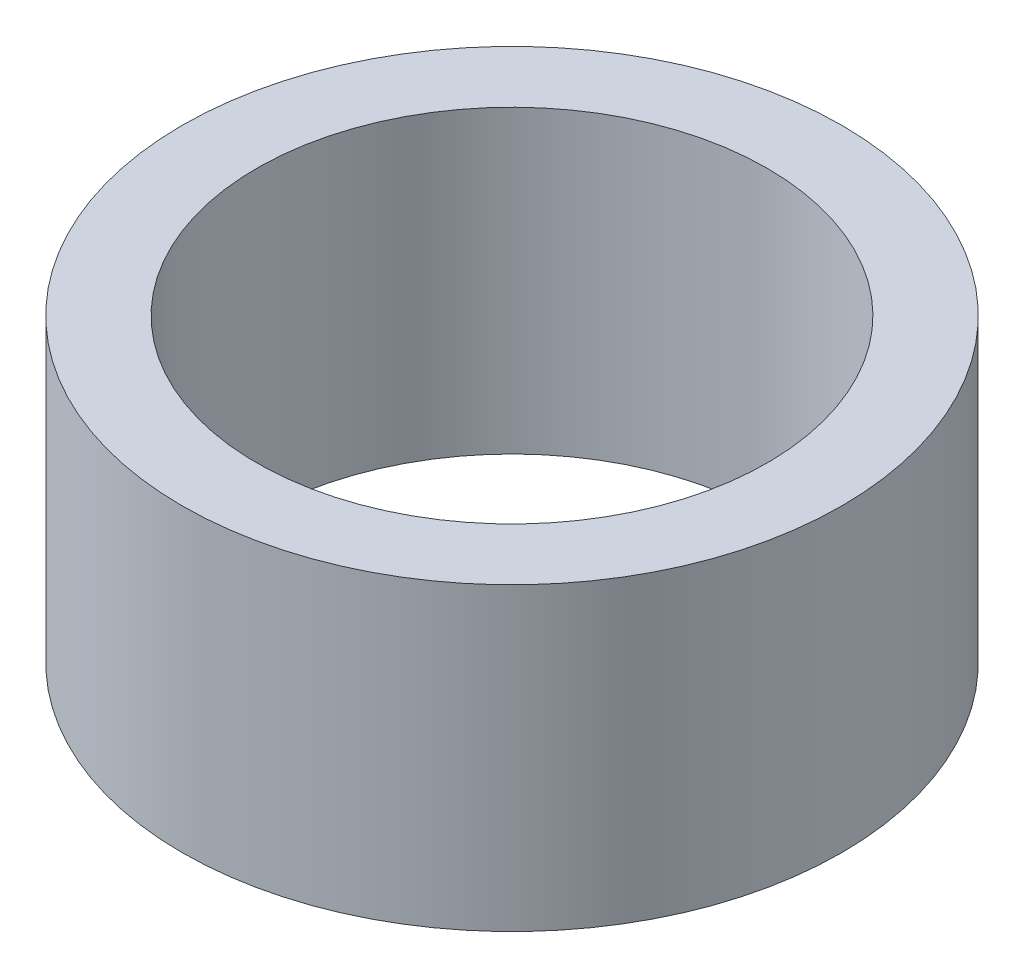
from build123d import *

# Parameters (mm, degrees)
SKETCH1_R           = 15
BOSS_EXTRUDE1_DEPTH = 13.663894989
SKETCH2_R           = 11.611398964
CUT_EXTRUDE1_DEPTH  = 26.232955163


with BuildPart() as part:
    # Sketch1 → Boss-Extrude1 (new body)
    with BuildSketch(Plane(origin=(0, 0, 0), x_dir=(1, 0, 0), z_dir=(0, 1, 0))):
        Circle(SKETCH1_R)
    extrude(amount=BOSS_EXTRUDE1_DEPTH)

    # Sketch2 → Cut-Extrude1 (cut, through all)
    with BuildSketch(Plane(origin=(0, 0, 0), x_dir=(1, 0, 0), z_dir=(0, 1, 0))):
        Circle(SKETCH2_R)
    extrude(amount=CUT_EXTRUDE1_DEPTH, mode=Mode.SUBTRACT)


solid = part.part
